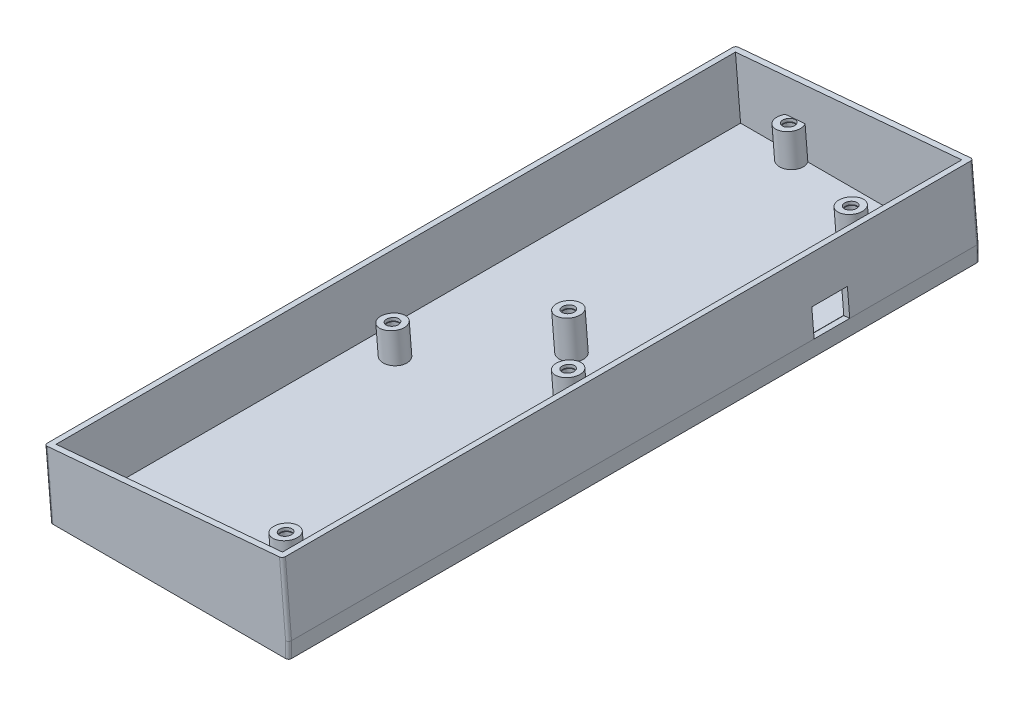
from build123d import *

# Parameters (mm, degrees)
SALIENTE_EXTRUIR1_DEPTH = 233
VACIADO1_T              = -2
SALIENTE_EXTRUIR2_REACH = 250.108
CROQUIS3_R              = 3.999999999999999
CROQUIS3_R_2            = 4.000000000000005
CROQUIS3_R_3            = 4.000000000000013
CROQUIS3_R_4            = 4.000000000000007
CROQUIS3_R_5            = 4.000000000000002
CROQUIS3_R_6            = 4
CROQUIS4_R              = 1.5000000000000007
CROQUIS4_R_2            = 1.4999999999999973
CROQUIS4_R_3            = 1.5000000000000042
CROQUIS4_R_4            = 1.5000000000000024
CROQUIS4_R_5            = 1.5000000000000009
CORTAR_EXTRUIR1_DEPTH   = 10
CROQUIS5_R              = 1.7500000000000002
CROQUIS5_R_2            = 1.7499999999999893
CROQUIS5_R_3            = 1.7500000000000038
CROQUIS5_R_4            = 1.749999999999997
CROQUIS5_R_5            = 1.7499999999999987
CROQUIS5_R_6            = 1.7500000000000004
CORTAR_EXTRUIR2_DEPTH   = 5
CROQUIS6_R              = 2.0000000000000036
CROQUIS6_R_2            = 1.9999999999999967
CROQUIS6_R_3            = 1.99999999999999
CROQUIS6_R_4            = 2.000000000000003
CORTAR_EXTRUIR3_DEPTH   = 1
CORTAR_EXTRUIR4_DEPTH   = 2
REDONDEO1_R             = 1


with BuildPart() as part:
    # Croquis1 → Saliente-Extruir1 (new body)
    with BuildSketch(Plane.XY):
        Polygon((82.35016819503933, 0), (82.35016819503927, 5.229344564858981), (80.29329266619476, 28.7395394398242), (78.30090327001128, 28.565227954328893), (1.9923893961834915, 21.889098059858902), (-1.33e-15, 21.7147865743636), (1.899797656141601, 0), align=None)
    extrude(amount=SALIENTE_EXTRUIR1_DEPTH)

    # Vaciado1
    vaciado1_openings = [part.faces().sort_by_distance(p)[0] for p in [
        (40.146646333, 25.227163007, 116.5),
    ]]
    offset(amount=VACIADO1_T, openings=vaciado1_openings, kind=Kind.INTERSECTION)

    # Saliente-Extruir2: up to this plane
    saliente_extruir2_end = Plane(origin=(1.899797656141601, 2, 233), z_dir=(0, 1, 0))
    # Croquis3 → Saliente-Extruir2 (add, up to the surface)
    with BuildSketch(Plane(origin=(-0.9092222397584271, 10.392457755273615, 0), x_dir=(0.9961946980917462, 0.08715574274765005, 0), z_dir=(-0.08715574274765005, 0.9961946980917462, 0)), mode=Mode.PRIVATE) as saliente_extruir2_sk1:
        with Locations((23.14256835249537, -4.200000000000009)):
            Circle(CROQUIS3_R)
    saliente_extruir2_tool1 = split(extrude(saliente_extruir2_sk1.sketch, amount=-SALIENTE_EXTRUIR2_REACH, mode=Mode.PRIVATE), bisect_by=saliente_extruir2_end, keep=Keep.BOTH, mode=Mode.PRIVATE)
    add(saliente_extruir2_tool1.solids().sort_by_distance((22.145282, 12.409465, 4.2))[0])
    # Croquis3 → Saliente-Extruir2 (add, up to the surface)
    with BuildSketch(Plane(origin=(-0.9092222397584271, 10.392457755273615, 0), x_dir=(0.9961946980917462, 0.08715574274765005, 0), z_dir=(-0.08715574274765005, 0.9961946980917462, 0)), mode=Mode.PRIVATE) as saliente_extruir2_sk2:
        with Locations(Location((61.24256835249536, -21.250000000000004, 0), (0, 0, 180))):
            Circle(CROQUIS3_R_2)
    saliente_extruir2_tool2 = split(extrude(saliente_extruir2_sk2.sketch, amount=-SALIENTE_EXTRUIR2_REACH, mode=Mode.PRIVATE), bisect_by=saliente_extruir2_end, keep=Keep.BOTH, mode=Mode.PRIVATE)
    add(saliente_extruir2_tool2.solids().sort_by_distance((60.1003, 15.730099, 21.25))[0])
    # Croquis3 → Saliente-Extruir2 (add, up to the surface)
    with BuildSketch(Plane(origin=(-0.9092222397584271, 10.392457755273615, 0), x_dir=(0.9961946980917462, 0.08715574274765005, 0), z_dir=(-0.08715574274765005, 0.9961946980917462, 0)), mode=Mode.PRIVATE) as saliente_extruir2_sk3:
        with Locations(Location((42.19256835249537, -97.45, 0), (0, 0, 180))):
            Circle(CROQUIS3_R_3)
    saliente_extruir2_tool3 = split(extrude(saliente_extruir2_sk3.sketch, amount=-SALIENTE_EXTRUIR2_REACH, mode=Mode.PRIVATE), bisect_by=saliente_extruir2_end, keep=Keep.BOTH, mode=Mode.PRIVATE)
    add(saliente_extruir2_tool3.solids().sort_by_distance((41.122791, 14.069782, 97.45))[0])
    # Croquis3 → Saliente-Extruir2 (add, up to the surface)
    with BuildSketch(Plane(origin=(-0.9092222397584271, 10.392457755273615, 0), x_dir=(0.9961946980917462, 0.08715574274765005, 0), z_dir=(-0.08715574274765005, 0.9961946980917462, 0)), mode=Mode.PRIVATE) as saliente_extruir2_sk4:
        with Locations(Location((61.24256835249536, -116.5, 0), (0, 0, 180))):
            Circle(CROQUIS3_R_4)
    saliente_extruir2_tool4 = split(extrude(saliente_extruir2_sk4.sketch, amount=-SALIENTE_EXTRUIR2_REACH, mode=Mode.PRIVATE), bisect_by=saliente_extruir2_end, keep=Keep.BOTH, mode=Mode.PRIVATE)
    add(saliente_extruir2_tool4.solids().sort_by_distance((60.1003, 15.730099, 116.5))[0])
    # Croquis3 → Saliente-Extruir2 (add, up to the surface)
    with BuildSketch(Plane(origin=(-0.9092222397584271, 10.392457755273615, 0), x_dir=(0.9961946980917462, 0.08715574274765005, 0), z_dir=(-0.08715574274765005, 0.9961946980917462, 0)), mode=Mode.PRIVATE) as saliente_extruir2_sk5:
        with Locations(Location((13.62256835249537, -128.26000000000002, 0), (0, 0, 180))):
            Circle(CROQUIS3_R_5)
    saliente_extruir2_tool5 = split(extrude(saliente_extruir2_sk5.sketch, amount=-SALIENTE_EXTRUIR2_REACH, mode=Mode.PRIVATE), bisect_by=saliente_extruir2_end, keep=Keep.BOTH, mode=Mode.PRIVATE)
    add(saliente_extruir2_tool5.solids().sort_by_distance((12.661508, 11.579743, 128.26))[0])
    # Croquis3 → Saliente-Extruir2 (add, up to the surface)
    with BuildSketch(Plane(origin=(-0.9092222397584271, 10.392457755273615, 0), x_dir=(0.9961946980917462, 0.08715574274765005, 0), z_dir=(-0.08715574274765005, 0.9961946980917462, 0)), mode=Mode.PRIVATE) as saliente_extruir2_sk6:
        with Locations((23.14256835249537, -228.8)):
            Circle(CROQUIS3_R_6)
    saliente_extruir2_tool6 = split(extrude(saliente_extruir2_sk6.sketch, amount=-SALIENTE_EXTRUIR2_REACH, mode=Mode.PRIVATE), bisect_by=saliente_extruir2_end, keep=Keep.BOTH, mode=Mode.PRIVATE)
    add(saliente_extruir2_tool6.solids().sort_by_distance((22.145282, 12.409465, 228.8))[0])
    # Croquis3 → Saliente-Extruir2 (add, up to the surface)
    with BuildSketch(Plane(origin=(-0.9092222397584271, 10.392457755273615, 0), x_dir=(0.9961946980917462, 0.08715574274765005, 0), z_dir=(-0.08715574274765005, 0.9961946980917462, 0)), mode=Mode.PRIVATE) as saliente_extruir2_sk7:
        with Locations(Location((61.24256835249536, -211.75000000000003, 0), (0, 0, 180))):
            Circle(CROQUIS3_R_4)
    saliente_extruir2_tool7 = split(extrude(saliente_extruir2_sk7.sketch, amount=-SALIENTE_EXTRUIR2_REACH, mode=Mode.PRIVATE), bisect_by=saliente_extruir2_end, keep=Keep.BOTH, mode=Mode.PRIVATE)
    add(saliente_extruir2_tool7.solids().sort_by_distance((60.1003, 15.730099, 211.75))[0])

    # Croquis4 → Cortar-Extruir1 (cut)
    with BuildSketch(Plane(origin=(-0.9092222397584271, 10.392457755273613, 0), x_dir=(0.9961946980917462, 0.08715574274765006, 0), z_dir=(-0.08715574274765006, 0.9961946980917462, 0))):
        with Locations(Location((23.142568352495374, -4.200000000000009, 0), (0, 0, 180))):
            Circle(CROQUIS4_R)
        with Locations(Location((61.24256835249536, -21.250000000000004, 0), (0, 0, 180))):
            Circle(CROQUIS4_R_2)
        with Locations(Location((42.192568352495364, -97.45, 0), (0, 0, 180))):
            Circle(CROQUIS4_R_3)
        with Locations(Location((61.24256835249536, -116.5, 0), (0, 0, 180))):
            Circle(CROQUIS4_R_2)
        with Locations(Location((13.622568352495366, -128.26000000000002, 0), (0, 0, 180))):
            Circle(CROQUIS4_R_4)
        with Locations(Location((61.24256835249536, -211.75000000000003, 0), (0, 0, 180))):
            Circle(CROQUIS4_R_2)
        with Locations(Location((23.142568352495374, -228.8, 0), (0, 0, 180))):
            Circle(CROQUIS4_R_5)
    extrude(amount=-CORTAR_EXTRUIR1_DEPTH, mode=Mode.SUBTRACT)

    # Croquis5 → Cortar-Extruir2 (cut)
    with BuildSketch(Plane(origin=(-0.9092222397584274, 10.392457755273616, 0), x_dir=(0.9961946980917462, 0.08715574274765006, 0), z_dir=(-0.08715574274765006, 0.9961946980917462, 0))):
        with Locations(Location((23.14256835249537, -4.200000000000009, 0), (0, 0, 180))):
            Circle(CROQUIS5_R)
        with Locations(Location((61.242568352495354, -21.250000000000004, 0), (0, 0, 180))):
            Circle(CROQUIS5_R_2)
        with Locations(Location((42.192568352495364, -97.45, 0), (0, 0, 180))):
            Circle(CROQUIS5_R_3)
        with Locations(Location((61.24256835249536, -116.5, 0), (0, 0, 180))):
            Circle(CROQUIS5_R_4)
        with Locations(Location((13.622568352495364, -128.26000000000002, 0), (0, 0, 180))):
            Circle(CROQUIS5_R_5)
        with Locations(Location((23.142568352495374, -228.8, 0), (0, 0, 180))):
            Circle(CROQUIS5_R_6)
        with Locations(Location((61.24256835249536, -211.75000000000003, 0), (0, 0, 180))):
            Circle(CROQUIS5_R_4)
    extrude(amount=-CORTAR_EXTRUIR2_DEPTH, mode=Mode.SUBTRACT)

    # Croquis6 → Cortar-Extruir3 (cut)
    with BuildSketch(Plane(origin=(-0.9092222397584271, 10.392457755273613, 0), x_dir=(0.9961946980917462, 0.08715574274765006, 0), z_dir=(-0.08715574274765006, 0.9961946980917462, 0))):
        with Locations(Location((13.622568352495366, -128.26000000000002, 0), (0, 0, 180))):
            Circle(CROQUIS6_R)
        with Locations(Location((23.142568352495374, -228.8, 0), (0, 0, 180))):
            Circle(CROQUIS6_R)
        with Locations(Location((61.24256835249536, -211.75000000000003, 0), (0, 0, 180))):
            Circle(CROQUIS6_R_2)
        with Locations(Location((61.242568352495354, -116.5, 0), (0, 0, 180))):
            Circle(CROQUIS6_R_3)
        with Locations(Location((42.192568352495364, -97.45, 0), (0, 0, 180))):
            Circle(CROQUIS6_R)
        with Locations(Location((61.24256835249536, -21.250000000000004, 0), (0, 0, 180))):
            Circle(CROQUIS6_R_2)
        with Locations(Location((23.14256835249537, -4.200000000000009, 0), (0, 0, 180))):
            Circle(CROQUIS6_R_4)
    extrude(amount=-CORTAR_EXTRUIR3_DEPTH, mode=Mode.SUBTRACT)

    # Croquis7 → Cortar-Extruir4 (cut)
    with BuildSketch(Plane(origin=(82.17865922472689, 7.189701065922963, 0), x_dir=(0, 0, -1), z_dir=(0.9961946980917464, 0.08715574274764931, 0))):
        Polygon((-55.83000000000002, -1.9678447444250866), (-43.830000000000005, -1.9678447444250844), (-43.83000000000001, 7.032155255574915), (-55.83000000000001, 7.032155255574913), align=None)
    extrude(amount=-CORTAR_EXTRUIR4_DEPTH, mode=Mode.SUBTRACT)

    # Redondeo1
    # the kernel refuses this fillet: 1 mm, written as the material it takes off along each edge
    with BuildSketch(Plane(origin=(82.5680575519084, 2.7388578196296147, 233), x_dir=(0, 0, -1), z_dir=(-0.08715574274764891, 0.9961946980917463, 0))) as redondeo1_piece_1:
        with BuildLine():
            CenterArc((REDONDEO1_R, REDONDEO1_R), REDONDEO1_R, 180, 90)
            Line((0, REDONDEO1_R), (0, 0))
            Line((0, 0), (REDONDEO1_R, 0))
        make_face()
    extrude(amount=28.6, mode=Mode.SUBTRACT)
    with BuildSketch(Plane(origin=(-0.21788935686912936, 24.20527331959297, 233), x_dir=(0.9961946980917461, 0.0871557427476515, 0), z_dir=(0.0871557427476515, -0.9961946980917462, 0))) as redondeo1_piece_2:
        with BuildLine():
            CenterArc((REDONDEO1_R, -REDONDEO1_R), REDONDEO1_R, 90, 90)
            Line((2.65e-15, -REDONDEO1_R), (0, 0))
            Line((0, 0), (REDONDEO1_R, 0))
        make_face()
    extrude(amount=26.79773353136612, mode=Mode.SUBTRACT)
    with BuildSketch(Plane(origin=(-0.21788935686912936, 24.20527331959297, 0), x_dir=(0.9961946980917461, 0.0871557427476515, 0), z_dir=(0.0871557427476515, -0.9961946980917462, 0))) as redondeo1_piece_3:
        with BuildLine():
            CenterArc((REDONDEO1_R, REDONDEO1_R), REDONDEO1_R, 180, 90)
            Line((2.65e-15, REDONDEO1_R), (0, 0))
            Line((0, 0), (REDONDEO1_R, 0))
        make_face()
    extrude(amount=26.79773353136612, mode=Mode.SUBTRACT)
    with BuildSketch(Plane(origin=(82.35016819503936, -2.5000000000000004, 233), x_dir=(0, 0, -1), z_dir=(-1.087e-14, 1, 0))) as redondeo1_piece_4:
        with BuildLine():
            CenterArc((REDONDEO1_R, REDONDEO1_R), REDONDEO1_R, 180, 90)
            Line((0, REDONDEO1_R), (0, 0))
            Line((0, 0), (REDONDEO1_R, 0))
        make_face()
    extrude(amount=10.229344564858982, mode=Mode.SUBTRACT)
    with BuildSketch(Plane(origin=(82.5680575519084, 2.738857819629615, 0), x_dir=(4e-17, 0, 1), z_dir=(-0.08715574274764891, 0.9961946980917463, 0))) as redondeo1_piece_5:
        with BuildLine():
            CenterArc((REDONDEO1_R, -REDONDEO1_R), REDONDEO1_R, 90, 90)
            Line((-1.5e-16, -REDONDEO1_R), (0, 0))
            Line((0, 0), (REDONDEO1_R, 0))
        make_face()
    extrude(amount=28.6, mode=Mode.SUBTRACT)
    with BuildSketch(Plane(origin=(82.35016819503936, -2.5000000000000004, 0), x_dir=(0, 0, 1), z_dir=(-1.087e-14, 1, 0))) as redondeo1_piece_6:
        with BuildLine():
            CenterArc((REDONDEO1_R, -REDONDEO1_R), REDONDEO1_R, 90, 90)
            Line((-1.1e-16, -REDONDEO1_R), (0, 0))
            Line((0, 0), (REDONDEO1_R, 0))
        make_face()
    extrude(amount=10.229344564858982, mode=Mode.SUBTRACT)


solid = part.part
